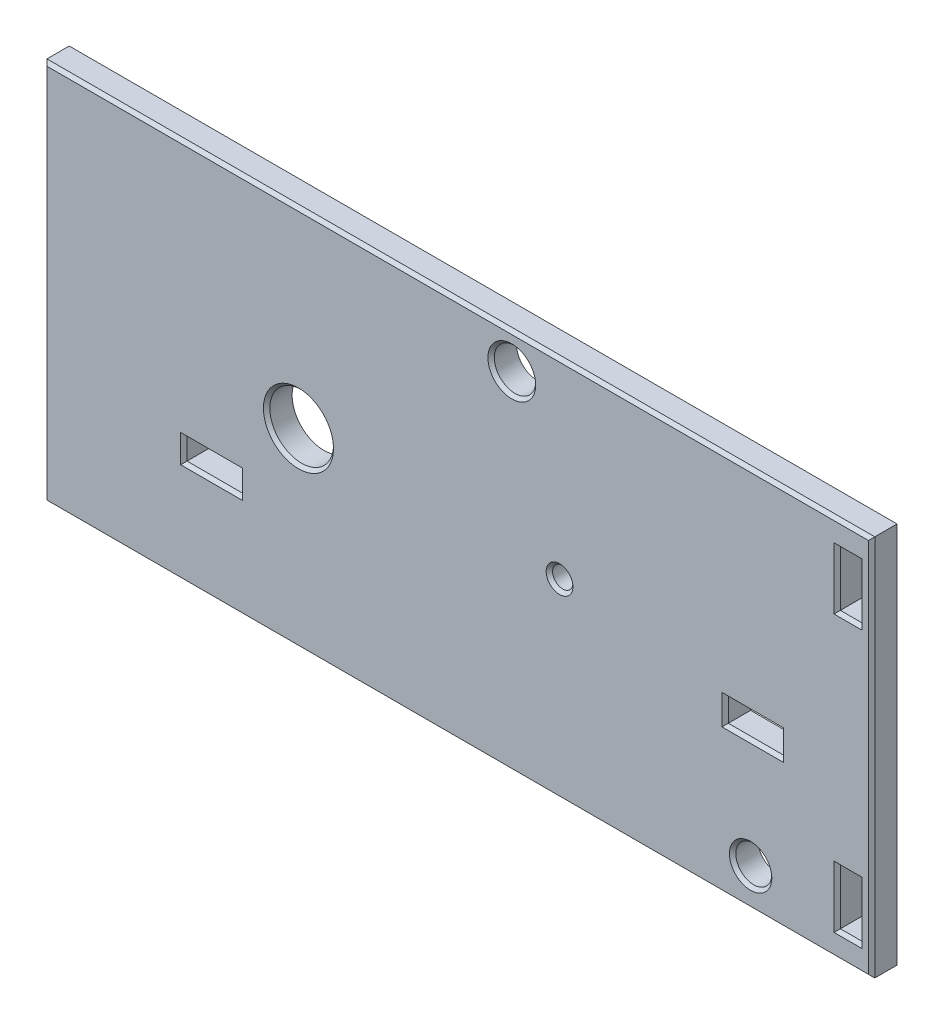
from build123d import *

# Parameters (mm, degrees)
SKETCH1_W           = 130
SKETCH1_H           = 60
SKETCH1_R           = 5
SKETCH1_R_2         = 3.25
SKETCH1_R_3         = 2.83
SKETCH1_R_4         = 1.6
SKETCH1_W_2         = 8.7
SKETCH1_H_2         = 3.4
SKETCH1_W_3         = 3.4
SKETCH1_H_3         = 8.7
SKETCH1_H_4         = 3.7
BOSS_EXTRUDE1_DEPTH = 2
CHAMFER1_SIZE       = 0.5


with BuildPart() as part:
    # Sketch1 → Boss-Extrude1 (new, symmetric)
    with BuildSketch(Plane.XY):
        with Locations((-21, 0)):
            Rectangle(SKETCH1_W, SKETCH1_H)
        with Locations((-46, 0)):
            Circle(SKETCH1_R, mode=Mode.SUBTRACT)
        with Locations((-12.5, 24.5)):
            Circle(SKETCH1_R_2, mode=Mode.SUBTRACT)
        with Locations((25, -24)):
            Circle(SKETCH1_R_3, mode=Mode.SUBTRACT)
        with Locations((-5, 0)):
            Circle(SKETCH1_R_4, mode=Mode.SUBTRACT)
        with Locations((-59.65, -12)):
            Rectangle(SKETCH1_W_2, SKETCH1_H_2, mode=Mode.SUBTRACT)
        with Locations((40.3, 21.65)):
            Rectangle(SKETCH1_W_3, SKETCH1_H_3, mode=Mode.SUBTRACT)
        with Locations((40.3, -21.65)):
            Rectangle(SKETCH1_W_3, SKETCH1_H_3, mode=Mode.SUBTRACT)
        with Locations((25.35, -5)):
            Rectangle(SKETCH1_W_2, SKETCH1_H_4, mode=Mode.SUBTRACT)
    extrude(amount=BOSS_EXTRUDE1_DEPTH, both=True)

    # Chamfer1
    chamfer1_edges = [part.edges().sort_by_distance(p)[0] for p in [
        (40.3, -26, 2),
        (42, -21.65, 2),
        (40.3, -17.3, 2),
        (38.6, -21.65, 2),
        (-6.6, 0, 2),
        (22.17, -24, 2),
        (-51, 0, 2),
        (-15.75, 24.5, 2),
        (-59.65, -13.7, 2),
        (-55.3, -12, 2),
        (-59.65, -10.3, 2),
        (-64, -12, 2),
        (-21, -30, 2),
        (-86, 0, 2),
        (-21, 30, 2),
        (44, 0, 2),
        (25.35, -6.85, 2),
        (29.7, -5, 2),
        (25.35, -3.15, 2),
        (21, -5, 2),
        (40.3, 17.3, 2),
        (42, 21.65, 2),
        (40.3, 26, 2),
        (38.6, 21.65, 2),
    ]]
    chamfer(chamfer1_edges, length=CHAMFER1_SIZE)


solid = part.part
